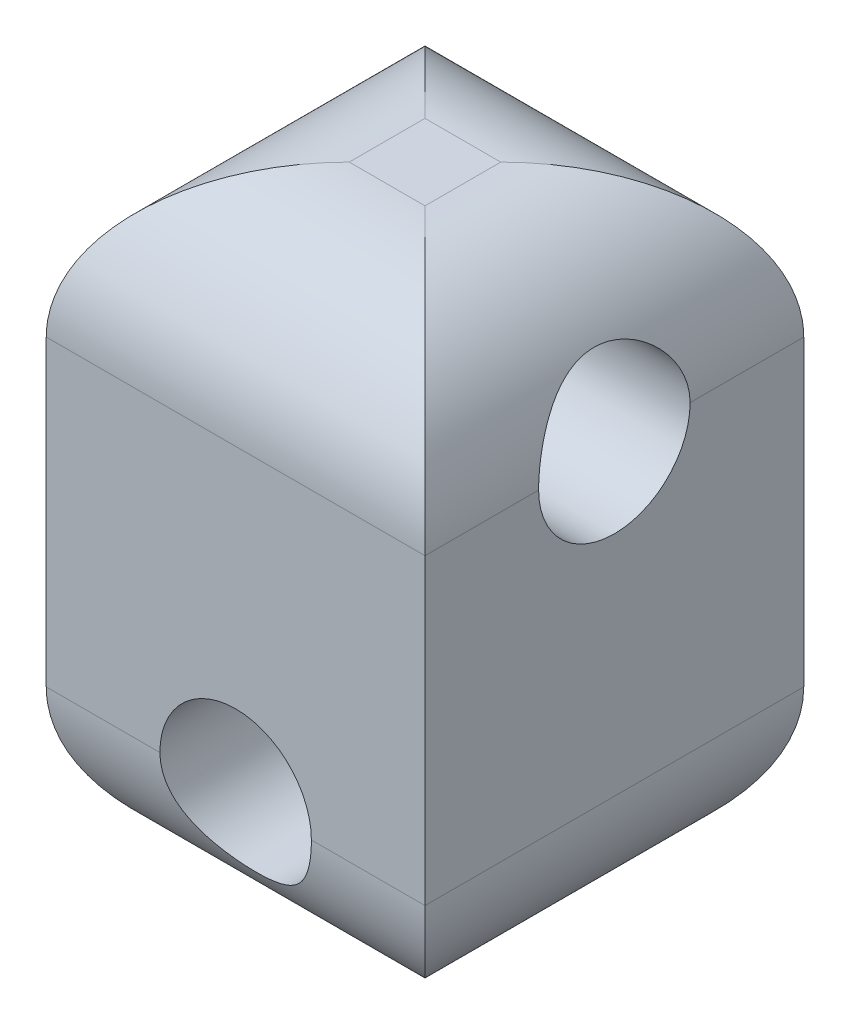
from build123d import *

# Parameters (mm, degrees)
CROQUIS1_W              = 2.5
CROQUIS1_H              = 4
SALIENTE_EXTRUIR1_DEPTH = 2.5
REDONDEO1_R             = 1
CROQUIS2_R              = 0.5
CORTAR_EXTRUIR1_DEPTH   = 2.5
CROQUIS4_R              = 0.5
CORTAR_EXTRUIR2_DEPTH   = 2.5
REDONDEO2_R             = 1
REDONDEO3_R             = 1


with BuildPart() as part:
    # Croquis1 → Saliente-Extruir1 (new body)
    with BuildSketch(Plane.XY):
        with Locations((-2.063472996, 3.723140496)):
            Rectangle(CROQUIS1_W, CROQUIS1_H)
    extrude(amount=SALIENTE_EXTRUIR1_DEPTH)

    # Redondeo1
    redondeo1_edges = [part.edges().sort_by_distance(p)[0] for p in [
        (-2.063472996, 5.723140496, 2.5),
        (-2.063472996, 5.723140496, 0),
        (-0.813472996, 1.723140496, 1.25),
        (-3.313472996, 1.723140496, 1.25),
    ]]
    fillet(redondeo1_edges, radius=REDONDEO1_R)

    # Croquis2 → Cortar-Extruir1 (cut)
    with BuildSketch(Plane(origin=(-0.813472996, 0, 0), x_dir=(0, 0, -1), z_dir=(1, 0, 0))):
        with Locations(Location((-1.25, 4.723140496, 0), (0, 0, 90))):
            Circle(CROQUIS2_R)
    extrude(amount=-CORTAR_EXTRUIR1_DEPTH, mode=Mode.SUBTRACT)

    # Croquis4 → Cortar-Extruir2 (cut)
    with BuildSketch(Plane.XY.offset(2.5)):
        with Locations((-2.063472996, 2.723140496)):
            Circle(CROQUIS4_R)
    extrude(amount=-CORTAR_EXTRUIR2_DEPTH, mode=Mode.SUBTRACT)

    # Redondeo2
    # the kernel refuses this fillet: 1 mm, written as the material it takes off along each edge
    with BuildSketch(Plane(origin=(-0.813472996, 5.723140496, -1.5), x_dir=(-1, 0, 0), z_dir=(0, 0, 1))) as redondeo2_piece_1:
        with BuildLine():
            CenterArc((REDONDEO2_R, REDONDEO2_R), REDONDEO2_R, 180, 90)
            Line((0, REDONDEO2_R), (0, 0))
            Line((0, 0), (REDONDEO2_R, 0))
        make_face()
    extrude(amount=5.5, mode=Mode.SUBTRACT)
    with BuildSketch(Plane(origin=(-3.313472996, 5.723140496, -1.5), x_dir=(1, 0, 0), z_dir=(0, 0, 1))) as redondeo2_piece_2:
        with BuildLine():
            CenterArc((REDONDEO2_R, -REDONDEO2_R), REDONDEO2_R, 90, 90)
            Line((0, -REDONDEO2_R), (0, 0))
            Line((0, 0), (REDONDEO2_R, 0))
        make_face()
    extrude(amount=5.5, mode=Mode.SUBTRACT)

    # Redondeo3
    # the kernel refuses this fillet: 1 mm, written as the material it takes off along each edge
    with BuildSketch(Plane(origin=(0.686527004, 1.723140496, 2.5), x_dir=(0, 1, 0), z_dir=(-1, 0, 0))) as redondeo3_piece_1:
        with BuildLine():
            CenterArc((REDONDEO3_R, REDONDEO3_R), REDONDEO3_R, 180, 90)
            Line((0, REDONDEO3_R), (0, 0))
            Line((0, 0), (REDONDEO3_R, 0))
        make_face()
    extrude(amount=5.5, mode=Mode.SUBTRACT)
    with BuildSketch(Plane(origin=(0.686527004, 1.723140496, 0), x_dir=(0, 1, 0), z_dir=(-1, 0, 0))) as redondeo3_piece_2:
        with BuildLine():
            CenterArc((REDONDEO3_R, -REDONDEO3_R), REDONDEO3_R, 90, 90)
            Line((0, -REDONDEO3_R), (0, 0))
            Line((0, 0), (REDONDEO3_R, 0))
        make_face()
    extrude(amount=5.5, mode=Mode.SUBTRACT)


solid = part.part
